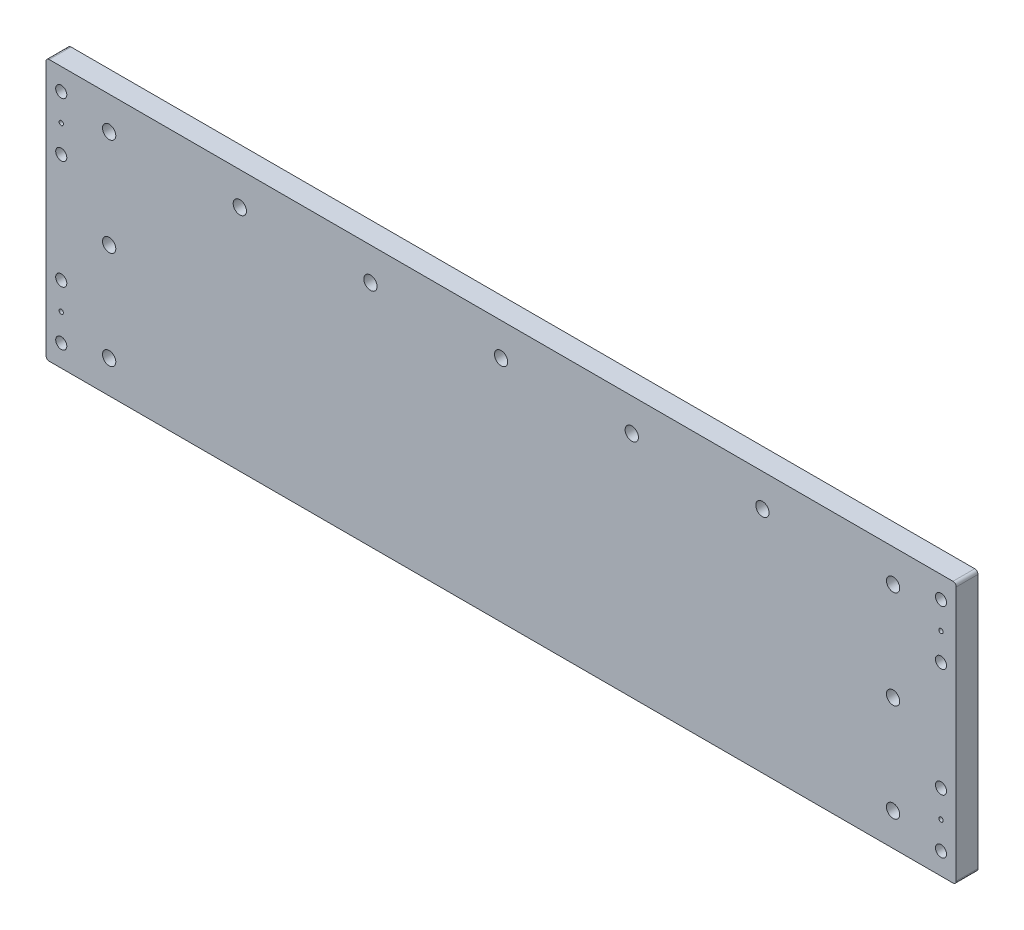
from build123d import *

# Parameters (mm, degrees)
SKETCH1_W                 = 418
SKETCH1_H                 = 120
BOSS_EXTRUDE1_DEPTH       = 5
SKETCH3_R                 = 3.05
CUT_EXTRUDE2_DEPTH        = 218.671771252
FILLET1_R                 = 1.5
SKETCH4_R                 = 2.55
SKETCH4_R_2               = 1
CUT_EXTRUDE3_DEPTH        = 218.671771252
MIRROR2_COPY_1_SKETCH_R   = 2.55
MIRROR2_COPY_1_SKETCH_R_2 = 1
MIRROR2_COPY_1_DEPTH      = 218.671771252


with BuildPart() as part:
    # Sketch1 → Boss-Extrude1 (new, symmetric)
    with BuildSketch(Plane.XY):
        Rectangle(SKETCH1_W, SKETCH1_H)
    extrude(amount=BOSS_EXTRUDE1_DEPTH, both=True)

    # Sketch3 → Cut-Extrude2 (cut, through all)
    with BuildSketch(Plane.XY.offset(5)):
        with Locations((-180, 45)):
            Circle(SKETCH3_R)
        with Locations((180, 45)):
            Circle(SKETCH3_R)
        with Locations((180, -45)):
            Circle(SKETCH3_R)
        with Locations((-180, -45)):
            Circle(SKETCH3_R)
        with Locations((0, 45)):
            Circle(SKETCH3_R)
        with Locations((-120, 45)):
            Circle(SKETCH3_R)
        with Locations((120, 45)):
            Circle(SKETCH3_R)
        with Locations((-180, 0)):
            Circle(SKETCH3_R)
        with Locations((-60, 45)):
            Circle(SKETCH3_R)
        with Locations((60, 45)):
            Circle(SKETCH3_R)
        with Locations((180, 0)):
            Circle(SKETCH3_R)
    extrude(amount=-CUT_EXTRUDE2_DEPTH, mode=Mode.SUBTRACT)

    # Fillet1
    fillet1_edges = [part.edges().sort_by_distance(p)[0] for p in [
        (-209, -60, 0),
        (209, -60, 0),
        (209, 60, 0),
        (-209, 60, 0),
    ]]
    fillet(fillet1_edges, radius=FILLET1_R)

    # Sketch4 → Cut-Extrude3 (cut, through all)
    with BuildSketch(Plane.XY.offset(5)):
        with Locations((-202, 50)):
            Circle(SKETCH4_R)
        with Locations((-202, 37.5)):
            Circle(SKETCH4_R_2)
        with Locations((-202, 25)):
            Circle(SKETCH4_R)
    cut_extrude3 = extrude(amount=-CUT_EXTRUDE3_DEPTH, mode=Mode.SUBTRACT)

    # Mirror1: Cut-Extrude3 across plane
    add(cut_extrude3.mirror(Plane.ZX), mode=Mode.SUBTRACT)

    # Mirror2: Cut-Extrude3 across plane
    add(cut_extrude3.mirror(Plane(origin=(0, 0, 0), x_dir=(0, 0, 1), z_dir=(1, 0, 0))), mode=Mode.SUBTRACT)

    # Mirror2 copy 1 sketch → Mirror2 copy 1 (cut, through all)
    with BuildSketch(Plane(origin=(0, 0, 5), x_dir=(-1, 0, 0), z_dir=(0, 0, 1))):
        with Locations((-202, 50)):
            Circle(MIRROR2_COPY_1_SKETCH_R)
        with Locations((-202, 37.5)):
            Circle(MIRROR2_COPY_1_SKETCH_R_2)
        with Locations((-202, 25)):
            Circle(MIRROR2_COPY_1_SKETCH_R)
    extrude(amount=-MIRROR2_COPY_1_DEPTH, mode=Mode.SUBTRACT)


solid = part.part
